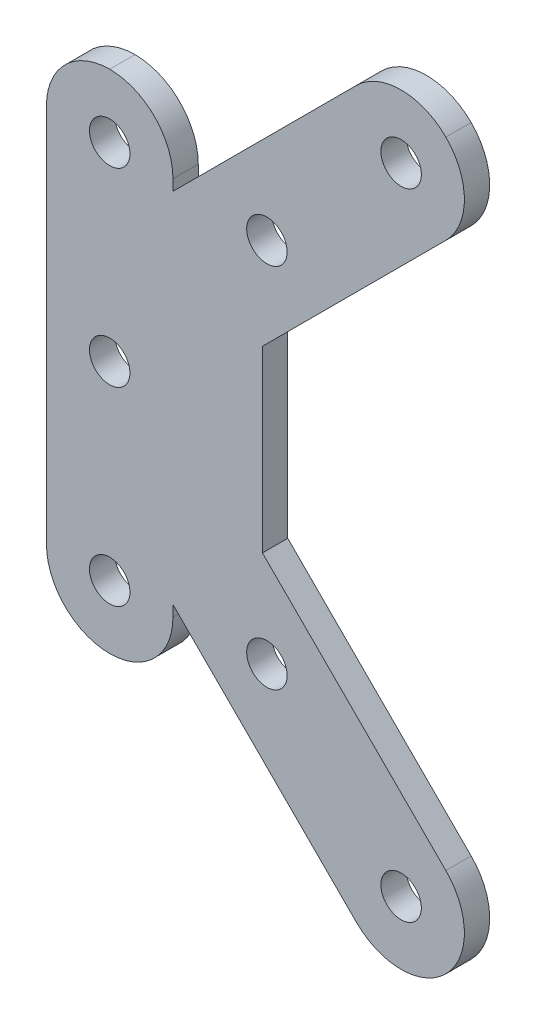
from build123d import *

# Parameters (mm, degrees)
SKETCH_1_R          = 1.6
EXTRUDE_1_DEPTH     = 1
SKETCH_2_R          = 1.6
CUT_EXTRUDE_1_DEPTH = 45.10524807
FILLET_1_R          = 5


with BuildPart() as part:
    # ｽｹｯﾁ1 → ﾎﾞｽ - 押し出し1 (new, symmetric)
    with BuildSketch(Plane.XY):
        Polygon((5, 20), (-5, 20), (-5, -20), (5, -20), (5, -14.142135624), (23.03122292, -32.173358544), (30.102290732, -25.102290732), (12.071067812, -7.071067812), (12.071067812, 7.071067812), (30.102290732, 25.102290732), (23.03122292, 32.173358544), (5, 14.142135624), align=None)
        with Locations((0, -15)):
            Circle(SKETCH_1_R, mode=Mode.SUBTRACT)
        Circle(SKETCH_1_R, mode=Mode.SUBTRACT)
        with Locations((0, 15)):
            Circle(SKETCH_1_R, mode=Mode.SUBTRACT)
    extrude(amount=EXTRUDE_1_DEPTH, both=True)

    # ｽｹｯﾁ2 → ｶｯﾄ - 押し出し1 (cut, through all)
    with BuildSketch(Plane.XY.offset(1)):
        with Locations((12.424621202, 14.495689014)):
            Circle(SKETCH_2_R)
        with Locations((23.03122292, 25.102290732)):
            Circle(SKETCH_2_R)
        with Locations(Location((12.424621202, -14.495689014, 0), (0, 0, 180))):
            Circle(SKETCH_2_R)
        with Locations(Location((23.03122292, -25.102290732, 0), (0, 0, 180))):
            Circle(SKETCH_2_R)
    extrude(amount=-CUT_EXTRUDE_1_DEPTH, mode=Mode.SUBTRACT)

    # ﾌｨﾚｯﾄ1
    fillet_1_edges = [part.edges().sort_by_distance(p)[0] for p in [
        (5, -20, 0),
        (-5, -20, 0),
        (23.03122292, -32.173358544, 0),
        (30.102290732, -25.102290732, 0),
        (30.102290732, 25.102290732, 0),
        (23.03122292, 32.173358544, 0),
        (5, 20, 0),
        (-5, 20, 0),
    ]]
    fillet(fillet_1_edges, radius=FILLET_1_R - 0.0001)  # a hair under: the kernel refuses the full size


solid = part.part
